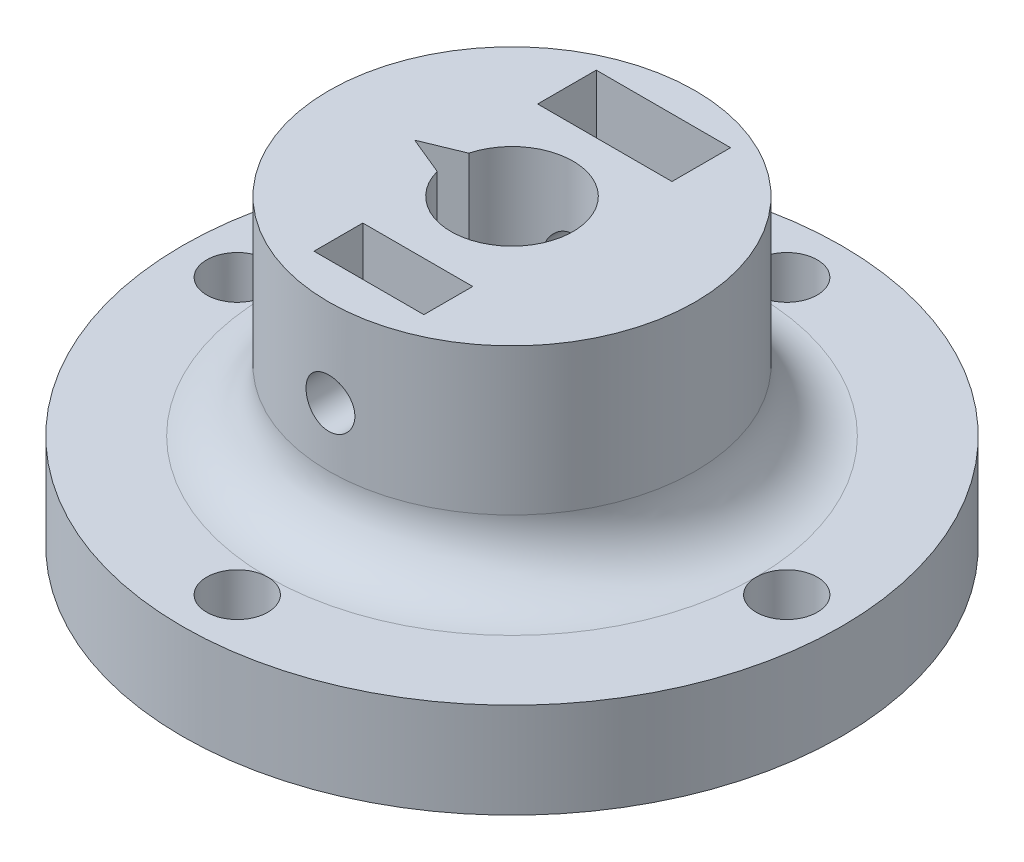
from build123d import *

# Parameters (mm, degrees)
SKETCH1_R               = 13.5
SKETCH1_R_2             = 1.25
BOSS_EXTRUDE2_DEPTH     = 2
SKETCH2_R               = 7.5
BOSS_EXTRUDE3_DEPTH     = 8.5
SKETCH4_R               = 2.5
CUT_EXTRUDE1_DEPTH      = 7.5
CUT_EXTRUDE2_DEPTH      = 7.5
CUT_EXTRUDE2_DEPTH_BACK = 11.75
SKETCH5_R               = 1
BOSS_EXTRUDE5_START     = 1.9
SKETCH7_R               = 13.5
SKETCH7_R_2             = 5.25
BOSS_EXTRUDE5_DEPTH     = 1.9
CUT_EXTRUDE3_DEPTH      = 8
FILLET1_R               = 2.5
SKETCH12_R              = 0.00537481
SKETCH12_R_2            = 0.008144056
SKETCH12_R_3            = 1.25
SKETCH12_R_4            = 0.012822725
CUT_EXTRUDE4_DEPTH      = 10
CIRPATTERN1_COUNT       = 4
SKETCH13_W              = 5.5
SKETCH13_H              = 2.4
SKETCH13_W_2            = 4.5
SKETCH13_H_2            = 2
CUT_EXTRUDE5_DEPTH      = 4
CUT_EXTRUDE6_DEPTH      = 2.4
CUT_EXTRUDE7_DEPTH      = 2


with BuildPart() as part:
    # Sketch1 → Boss-Extrude2 (new body)
    with BuildSketch(Plane(origin=(0, 0, 0), x_dir=(1, 0, 0), z_dir=(0, 1, 0))):
        with Locations(Location((0, 0, 0), (0, 0, 270))):
            Circle(SKETCH1_R)
        with Locations(Location((11.25, 0, 0), (0, 0, 270))):
            Circle(SKETCH1_R_2, mode=Mode.SUBTRACT)
        with Locations(Location((0, -11.25, 0), (0, 0, 270))):
            Circle(SKETCH1_R_2, mode=Mode.SUBTRACT)
        with Locations(Location((-11.25, 0, 0), (0, 0, 270))):
            Circle(SKETCH1_R_2, mode=Mode.SUBTRACT)
        with Locations(Location((0, 11.25, 0), (0, 0, 270))):
            Circle(SKETCH1_R_2, mode=Mode.SUBTRACT)
    extrude(amount=BOSS_EXTRUDE2_DEPTH)

    # Sketch2 → Boss-Extrude3 (add)
    with BuildSketch(Plane(origin=(0, 2, 0), x_dir=(1, 0, 0), z_dir=(0, 1, 0))):
        with Locations(Location((0, 0, 0), (0, 0, 270))):
            Circle(SKETCH2_R)
    extrude(amount=BOSS_EXTRUDE3_DEPTH)

    # Sketch4 → Cut-Extrude1 (cut)
    with BuildSketch(Plane(origin=(0, 10.5, 0), x_dir=(1, 0, 0), z_dir=(0, 1, 0))):
        with Locations(Location((0, 0, 0), (0, 0, 270))):
            Circle(SKETCH4_R)
    extrude(amount=-CUT_EXTRUDE1_DEPTH, mode=Mode.SUBTRACT)

    # Sketch5 → Cut-Extrude2 (cut, two sides: drawn at the far end of the back side and taken through both)
    with BuildSketch(Plane.XY.offset(-CUT_EXTRUDE2_DEPTH_BACK)):
        with Locations(Location((0, 6.914506731, 0), (0, 0, 180))):
            Circle(SKETCH5_R)
    extrude(amount=CUT_EXTRUDE2_DEPTH + CUT_EXTRUDE2_DEPTH_BACK, mode=Mode.SUBTRACT)

    # Sketch7 → Boss-Extrude5 (add)
    with BuildSketch(Plane.XZ.offset(BOSS_EXTRUDE5_START)):
        with Locations(Location((0, 0, 0), (0, 0, 270))):
            Circle(SKETCH7_R)
        with Locations(Location((0, 0, 0), (0, 0, 90))):
            Circle(SKETCH7_R_2, mode=Mode.SUBTRACT)
    extrude(amount=-BOSS_EXTRUDE5_DEPTH)

    # Sketch9 → Cut-Extrude3 (cut)
    with BuildSketch(Plane(origin=(0, 10.5, 0), x_dir=(1, 0, 0), z_dir=(0, 1, 0))):
        Polygon((-2.414753661, -0.64727487), (-2.414753661, 0.64727487), (-3.984419716, 0), align=None)
    extrude(amount=-CUT_EXTRUDE3_DEPTH, mode=Mode.SUBTRACT)

    # Fillet1
    fillet1_edges = [part.edges().sort_by_distance(p)[0] for p in [
        (0, 2, -7.5),
    ]]
    fillet(fillet1_edges, radius=FILLET1_R - 0.0001)  # a hair under: the kernel refuses the full size

    # Sketch12 → Cut-Extrude4 (cut)
    with BuildSketch(Plane(origin=(0, 0, 0), x_dir=(1, 0, 0), z_dir=(0, 1, 0))):
        with Locations(Location((-0.239113034, -10.028559531, 0), (0, 0, 101.087404696))):
            Circle(SKETCH12_R)
        with Locations(Location((-1.014615915, 11.966073133, 0), (0, 0, 144.78716899))):
            Circle(SKETCH12_R_2)
        with Locations(Location((-11, 0, 0), (0, 0, 264.260829523))):
            Circle(SKETCH12_R_3)
        with Locations(Location((10.492985163, 0.978537759, 0), (0, 0, 127.726196418))):
            Circle(SKETCH12_R_4)
    cut_extrude4 = extrude(amount=-CUT_EXTRUDE4_DEPTH, mode=Mode.SUBTRACT)

    # CirPattern1: Cut-Extrude4 ×4 about axis
    cirpattern1_axis = Axis((0, 0, 0), (0, 1, 0))
    for i in range(1, CIRPATTERN1_COUNT):
        add(cut_extrude4.rotate(cirpattern1_axis, i * 360 / CIRPATTERN1_COUNT), mode=Mode.SUBTRACT)

    # Sketch13 → Cut-Extrude5 (cut)
    with BuildSketch(Plane(origin=(0, 10.5, 0), x_dir=(1, 0, 0), z_dir=(0, 1, 0))):
        with Locations((0, 5)):
            Rectangle(SKETCH13_W, SKETCH13_H)
        with Locations((0.141735204, -5)):
            Rectangle(SKETCH13_W_2, SKETCH13_H_2)
    extrude(amount=-CUT_EXTRUDE5_DEPTH, mode=Mode.SUBTRACT)

    # Sketch14 → Cut-Extrude6 (cut)
    with BuildSketch(Plane(origin=(0, 0, -3.8), x_dir=(-1, 0, 0), z_dir=(0, 0, -1))):
        Polygon((2.721817224, 8.550063007), (-0.055524673, 10.089447729), (-2.777341897, 8.453891453), (-2.721817224, 5.278950455), (0.055524673, 3.739565732), (2.777341897, 5.375122009), align=None)
    extrude(amount=CUT_EXTRUDE6_DEPTH, mode=Mode.SUBTRACT)

    # Sketch15 → Cut-Extrude7 (cut)
    with BuildSketch(Plane.XY.offset(4)):
        Polygon((2.25, 8.213544837), (0, 9.512582942), (-2.25, 8.213544837), (-2.25, 5.615468625), (0, 4.31643052), (2.25, 5.615468625), align=None)
    extrude(amount=CUT_EXTRUDE7_DEPTH, mode=Mode.SUBTRACT)


solid = part.part
